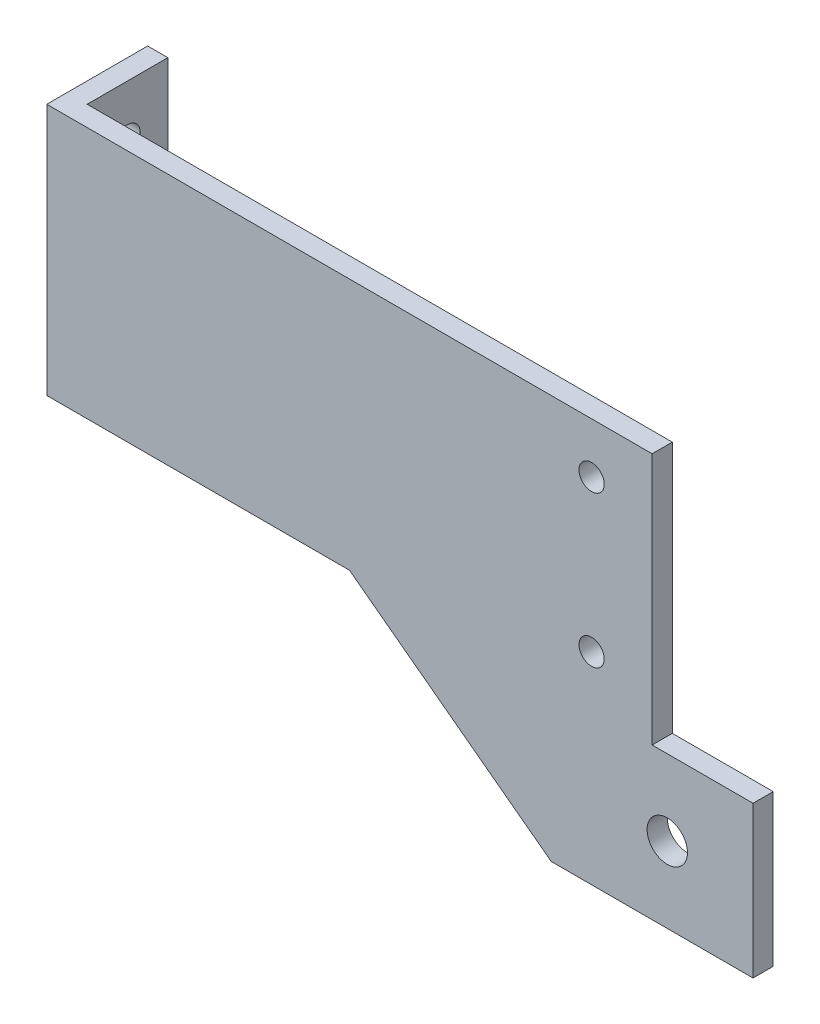
from build123d import *

# Parameters (mm, degrees)
EXTRUDE_1_DEPTH     = 80
SKETCH_2_R          = 2.5
CUT_EXTRUDE_1_DEPTH = 10
SKETCH_3_R          = 2.5
SKETCH_3_R_2        = 4
CUT_EXTRUDE_2_DEPTH = 10
CUT_EXTRUDE_3_DEPTH = 30
SKETCH_6_W          = 20
SKETCH_6_H          = 50
CUT_EXTRUDE_4_DEPTH = 10


with BuildPart() as part:
    # Эскиз1 → Бобышка-Вытянуть1 (new body)
    with BuildSketch(Plane(origin=(0, 0, 0), x_dir=(1, 0, 0), z_dir=(0, 1, 0))):
        Polygon((0, 0), (140, 0), (140, 4), (4, 4), (4, 20), (0, 20), (0, 4), align=None)
    extrude(amount=EXTRUDE_1_DEPTH)

    # Эскиз2 → Вырез-Вытянуть1 (cut)
    with BuildSketch(Plane.ZY):
        with Locations((-12, 70)):
            Circle(SKETCH_2_R)
        with Locations((-12, 40)):
            Circle(SKETCH_2_R)
    extrude(amount=-CUT_EXTRUDE_1_DEPTH, mode=Mode.SUBTRACT)

    # Эскиз3 → Вырез-Вытянуть2 (cut)
    with BuildSketch(Plane.XY):
        with Locations((108, 70)):
            Circle(SKETCH_3_R)
        with Locations((108, 40)):
            Circle(SKETCH_3_R)
        with Locations((123, 15)):
            Circle(SKETCH_3_R_2)
    extrude(amount=-CUT_EXTRUDE_2_DEPTH, mode=Mode.SUBTRACT)

    # Эскиз4 → Вырез-Вытянуть3 (cut)
    with BuildSketch(Plane.XY):
        Polygon((0, 30), (60, 30), (100, 0), (0, 0), align=None)
    extrude(amount=-CUT_EXTRUDE_3_DEPTH, mode=Mode.SUBTRACT)

    # Эскиз6 → Вырез-Вытянуть4 (cut)
    with BuildSketch(Plane.XY):
        with Locations((130, 55)):
            Rectangle(SKETCH_6_W, SKETCH_6_H)
    extrude(amount=-CUT_EXTRUDE_4_DEPTH, mode=Mode.SUBTRACT)


solid = part.part
